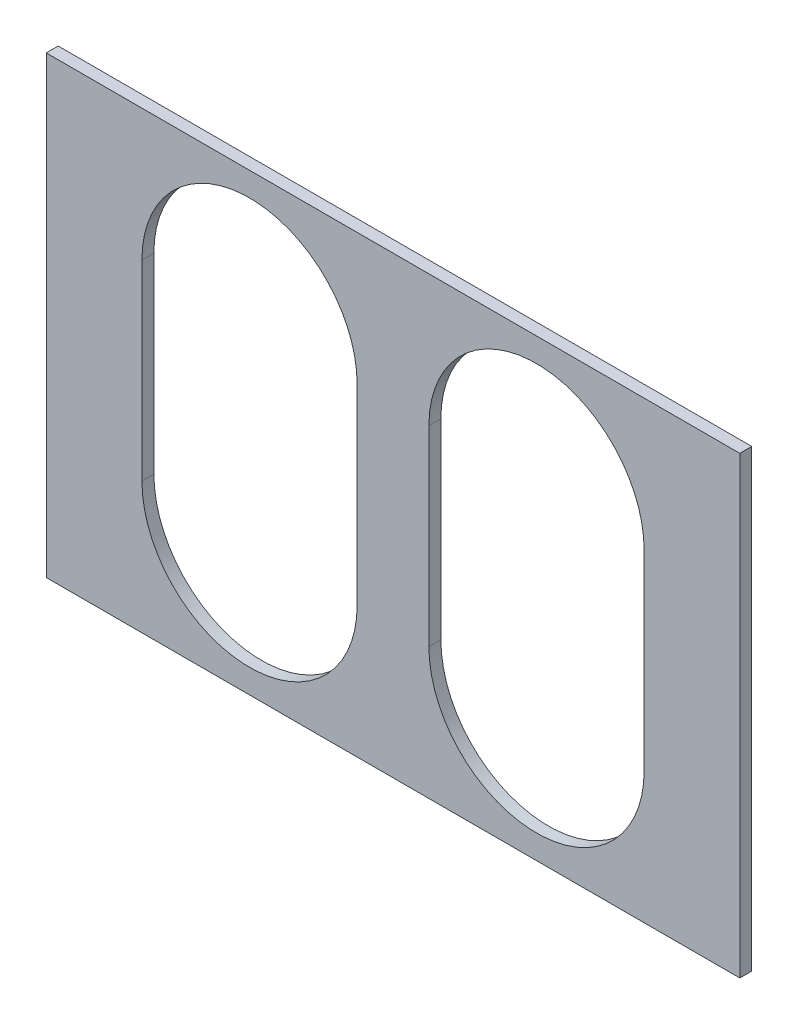
from build123d import *

# Parameters (mm, degrees)
SKETCH_1_W      = 290
SKETCH_1_H      = 190
EXTRUDE_1_DEPTH = 5


with BuildPart() as part:
    # Эскиз1 → Бобышка-Вытянуть1 (new body)
    with BuildSketch(Plane.XY):
        Rectangle(SKETCH_1_W, SKETCH_1_H)
        with BuildLine():
            Line((-15, 40), (-15, -40))
            ThreePointArc((-15, -40), (-60, -85), (-105, -40))
            Line((-105, -40), (-105, 40))
            ThreePointArc((-105, 40), (-60, 85), (-15, 40))
        make_face(mode=Mode.SUBTRACT)
        with BuildLine():
            Line((15, 40), (15, -40))
            ThreePointArc((15, -40), (60, -85), (105, -40))
            Line((105, -40), (105, 40))
            ThreePointArc((105, 40), (60, 85), (15, 40))
        make_face(mode=Mode.SUBTRACT)
    extrude(amount=EXTRUDE_1_DEPTH)


solid = part.part
